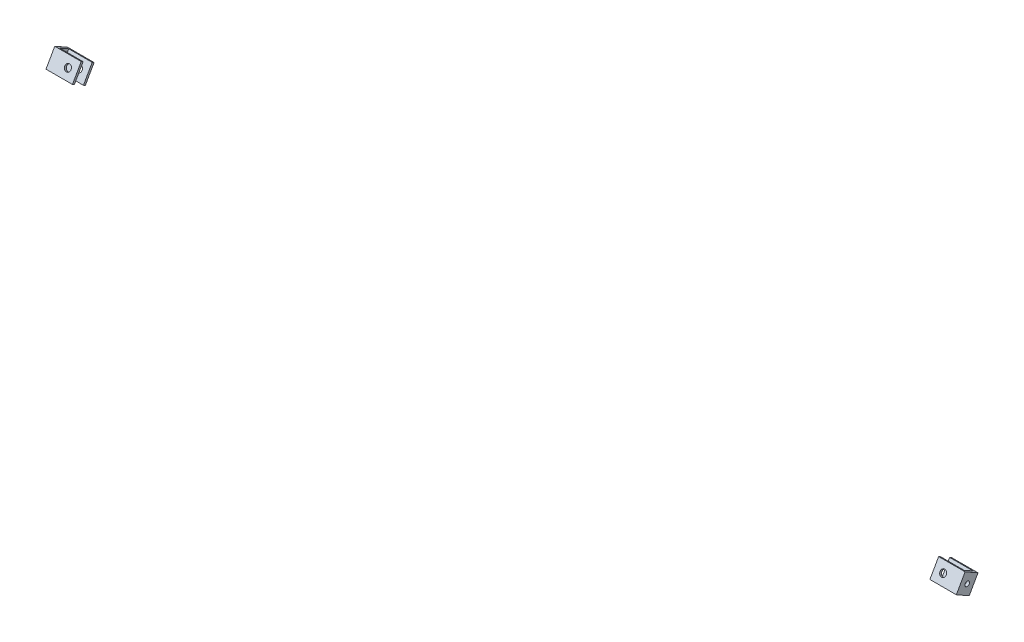
from build123d import *

# Parameters (mm, degrees)
SKETCH1_W           = 28.321
SKETCH1_H           = 19.05
SKETCH1_R           = 3.3782
BOSS_EXTRUDE1_DEPTH = 7.9375
SKETCH2_W           = 31.794417924
SKETCH2_H           = 11.1125
CUT_EXTRUDE1_DEPTH  = 670.195014149
SKETCH3_R           = 2.5527
CUT_EXTRUDE2_DEPTH  = 1371.562973476


with BuildPart() as part:
    # Sketch1 → Boss-Extrude1 (new, symmetric)
    with BuildSketch(Plane(origin=(0, -217.945214779, -384.948202745), x_dir=(-1, 0, 0), z_dir=(0, -0.4926838295770631, -0.8702083911760905))):
        with Locations((473.289499952, 1279.170858512)):
            Rectangle(SKETCH1_W, SKETCH1_H)
        with Locations((468.653999952, 1279.170858512)):
            Circle(SKETCH1_R, mode=Mode.SUBTRACT)
    extrude(amount=BOSS_EXTRUDE1_DEPTH, both=True)

    # Sketch2 → Cut-Extrude1 (cut, through all)
    with BuildSketch(Plane(origin=(0, 1104.856479899, -625.533983778), x_dir=(1, 0, 0), z_dir=(0, -0.8702083911760903, 0.49268382957706325))):
        with Locations((-468.37779099, -442.363239252)):
            Rectangle(SKETCH2_W, SKETCH2_H)
    extrude(amount=-CUT_EXTRUDE1_DEPTH, mode=Mode.SUBTRACT)

    # Sketch3 → Cut-Extrude2 (cut, through all)
    with BuildSketch(Plane.ZY.offset(487.449999952)):
        with Locations((-1015.175, 895.200000046)):
            Circle(SKETCH3_R)
    extrude(amount=-CUT_EXTRUDE2_DEPTH, mode=Mode.SUBTRACT)


with BuildPart() as body_2:
    # Mirror2: mirrored copy
    add(part.part.mirror(Plane(origin=(0, 0, 0), x_dir=(0, 0, 1), z_dir=(1, 0, 0))))


solid = Compound([part.part, body_2.part])
